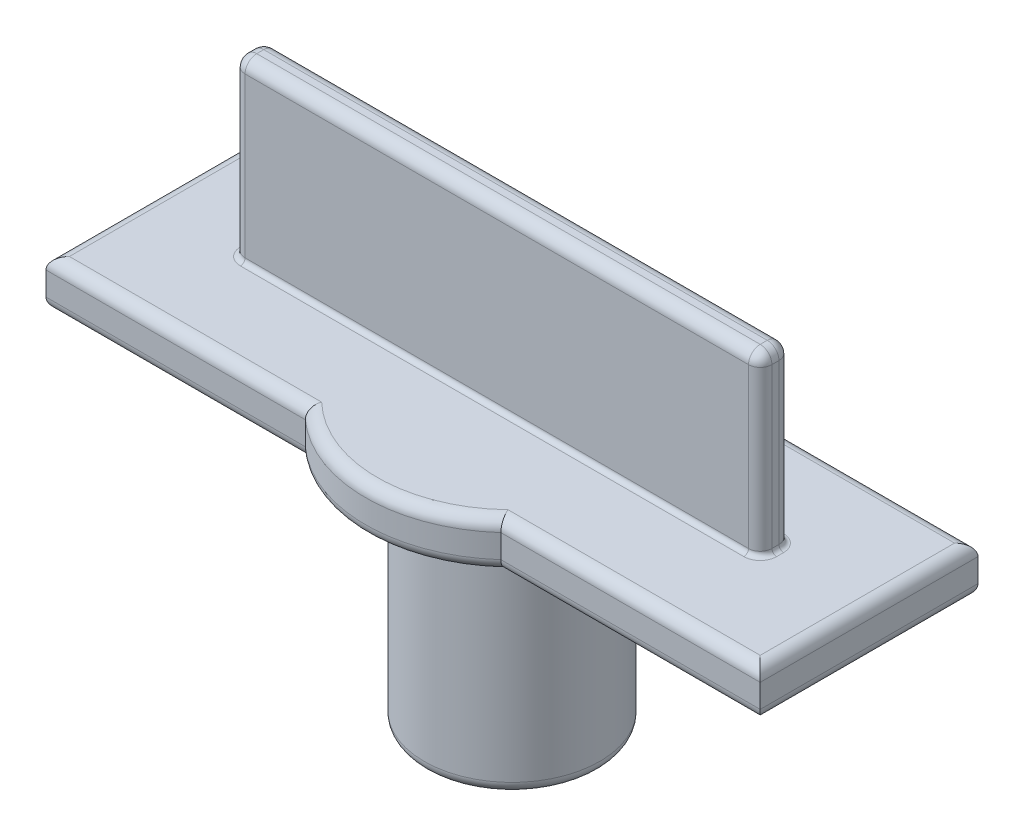
from build123d import *

# Parameters (mm, degrees)
SKETCH1_R           = 9.525
SKETCH1_R_2         = 4.699
BOSS_EXTRUDE1_DEPTH = 25.4
SKETCH2_R           = 15.875
SKETCH2_R_2         = 1.5875
BOSS_EXTRUDE2_DEPTH = 5.08
SKETCH3_W           = 57.15
SKETCH3_H           = 3.302
BOSS_EXTRUDE3_DEPTH = 19.05
SKETCH4_W           = 77.47
SKETCH4_H           = 23.622
BOSS_EXTRUDE4_DEPTH = 5.08
SWEEP1_PITCH        = 1.5875
SKETCH11_W          = 15.441036164
SKETCH11_H          = 16.291790836
CUT_EXTRUDE1_DEPTH  = 5.08
SKETCH12_R          = 3.96875
CUT_EXTRUDE2_DEPTH  = 25.4
FILLET1_R           = 1.27
FILLET2_R           = 1.27
FILLET3_R           = 1.27
FILLET4_R           = 3.81
FILLET5_R           = 0.508


with BuildPart() as part:
    # Sketch1 → Boss-Extrude1 (new body)
    with BuildSketch(Plane(origin=(0, 0, 0), x_dir=(1, 0, 0), z_dir=(0, 1, 0))):
        with Locations(Location((0, 0, 0), (0, 0, 270))):
            Circle(SKETCH1_R)
        with Locations(Location((0, 0, 0), (0, 0, 270))):
            Circle(SKETCH1_R_2, mode=Mode.SUBTRACT)
    extrude(amount=BOSS_EXTRUDE1_DEPTH)

    # Sketch2 → Boss-Extrude2 (add)
    with BuildSketch(Plane(origin=(0, 25.4, 0), x_dir=(1, 0, 0), z_dir=(0, 1, 0))):
        with Locations(Location((0, 0, 0), (0, 0, 270))):
            Circle(SKETCH2_R)
        with Locations(Location((0, 0, 0), (0, 0, 270))):
            Circle(SKETCH2_R_2, mode=Mode.SUBTRACT)
    extrude(amount=BOSS_EXTRUDE2_DEPTH)

    # Sketch3 → Boss-Extrude3 (add)
    with BuildSketch(Plane(origin=(0, 30.48, 0), x_dir=(1, 0, 0), z_dir=(0, 1, 0))):
        Rectangle(SKETCH3_W, SKETCH3_H)
    extrude(amount=BOSS_EXTRUDE3_DEPTH)

    # Sketch4 → Boss-Extrude4 (add)
    with BuildSketch(Plane.XZ.offset(-30.48)):
        Rectangle(SKETCH4_W, SKETCH4_H)
    extrude(amount=BOSS_EXTRUDE4_DEPTH)

    # Sweep1: the profile of Sketch7 screwed along a right-hand helix of 16 turns, 8 arcs to a turn; built about Z, then put on its axis
    sweep1_z = Axis((0, 0, 0), (0, 0, 1))
    sweep1_corners = [(4.699, 0, 0), (4.699, 0, 0.6985), (3.683, 0, 0), (4.699, 0, -0.6985)]
    with BuildLine(mode=Mode.PRIVATE) as sweep1_profile:
        Line(sweep1_corners[0], sweep1_corners[1])
        Line(sweep1_corners[1], sweep1_corners[2])
        Line(sweep1_corners[2], sweep1_corners[3])
        Line(sweep1_corners[3], sweep1_corners[0])
    sweep1_cap = Face(sweep1_profile.wire())
    sweep1_turn_angles = [0, 22.5, 45, 67.5, 90, 112.5, 135, 157.5, 180, 202.5, 225, 247.5, 270, 292.5, 315, 337.5, 360]
    sweep1_turn_weights = [1, 0.9238795325112867, 1, 0.9238795325112867, 1, 0.9238795325112867, 1, 0.9238795325112867, 1, 0.9238795325112867, 1, 0.9238795325112867, 1, 0.9238795325112867, 1, 0.9238795325112867, 1]
    sweep1_turn_rails = [Edge.make_bspline([Vector(p[0], p[1], 0).rotate(sweep1_z, sweep1_turn_angles[k]) / sweep1_turn_weights[k] + Vector(0, 0, p[2] + SWEEP1_PITCH * sweep1_turn_angles[k] / 360) for k in range(17)], [0, 0, 0, 1, 1, 2, 2, 3, 3, 4, 4, 5, 5, 6, 6, 7, 7, 8, 8, 8], 2, sweep1_turn_weights) for p in sweep1_corners]
    sweep1_turn_sides = [Face.make_surface_from_curves(sweep1_turn_rails[p[0]], sweep1_turn_rails[p[1]]) for p in [(0, 1), (1, 2), (2, 3), (3, 0)]]
    sweep1 = Plane(origin=(0, 0, 0), x_dir=(-0.7071067811865537, 0, 0.7071067811865414), z_dir=(0, 1, 0)) * Solid(Shell([*[p.moved(Location((0, 0, SWEEP1_PITCH * i))) for i in range(16) for p in sweep1_turn_sides], sweep1_cap, sweep1_cap.rotate(sweep1_z, 5760).moved(Location((0, 0, SWEEP1_PITCH * 5760 / 360)))]))
    add(sweep1)

    # Sketch11 → Cut-Extrude1 (cut)
    with BuildSketch(Plane.XZ):
        Rectangle(SKETCH11_W, SKETCH11_H)
    extrude(amount=CUT_EXTRUDE1_DEPTH, mode=Mode.SUBTRACT)

    # Sketch12 → Cut-Extrude2 (cut)
    with BuildSketch(Plane.XZ):
        Circle(SKETCH12_R)
    extrude(amount=-CUT_EXTRUDE2_DEPTH, mode=Mode.SUBTRACT)

    # Fillet1
    fillet1_edges = [part.edges().sort_by_distance(p)[0] for p in [
        (28.575, 40.005, 1.651),
        (28.575, 40.005, -1.651),
        (-28.575, 40.005, -1.651),
        (-28.575, 40.005, 1.651),
        (28.575, 49.53, 0),
        (0, 49.53, -1.651),
        (-28.575, 49.53, 0),
        (0, 49.53, 1.651),
    ]]
    fillet(fillet1_edges, radius=FILLET1_R)

    # Fillet2
    fillet2_edges = [part.edges().sort_by_distance(p)[0] for p in [
        (0, 30.48, 15.875),
        (0, 30.48, -15.875),
        (24.671175707, 30.48, 11.811),
        (-24.671175707, 30.48, 11.811),
        (-24.671175707, 30.48, -11.811),
        (24.671175707, 30.48, -11.811),
        (38.735, 30.48, 0),
        (-38.735, 30.48, 0),
    ]]
    fillet(fillet2_edges, radius=FILLET2_R)

    # Fillet3
    fillet3_edges = [part.edges().sort_by_distance(p)[0] for p in [
        (0, 0, -9.525),
        (0, 25.4, -15.875),
        (0, 25.4, 15.875),
        (24.671175707, 25.4, -11.811),
        (38.735, 25.4, 0),
        (24.671175707, 25.4, 11.811),
        (-24.671175707, 25.4, 11.811),
        (-38.735, 25.4, 0),
        (-24.671175707, 25.4, -11.811),
    ]]
    fillet(fillet3_edges, radius=FILLET3_R)

    # Fillet4
    fillet4_edges = [part.edges().sort_by_distance(p)[0] for p in [
        (0, 25.4, -9.525),
    ]]
    fillet(fillet4_edges, radius=FILLET4_R)

    # Fillet5
    fillet5_edges = [part.edges().sort_by_distance(p)[0] for p in [
        (0, 30.48, 1.651),
        (-28.575, 30.48, 0),
        (0, 30.48, -1.651),
        (28.575, 30.48, 0),
        (28.203025612, 30.48, 1.279025612),
        (28.203025612, 30.48, -1.279025612),
        (-28.203025612, 30.48, 1.279025612),
        (-28.203025612, 30.48, -1.279025612),
    ]]
    fillet(fillet5_edges, radius=FILLET5_R)


solid = part.part
